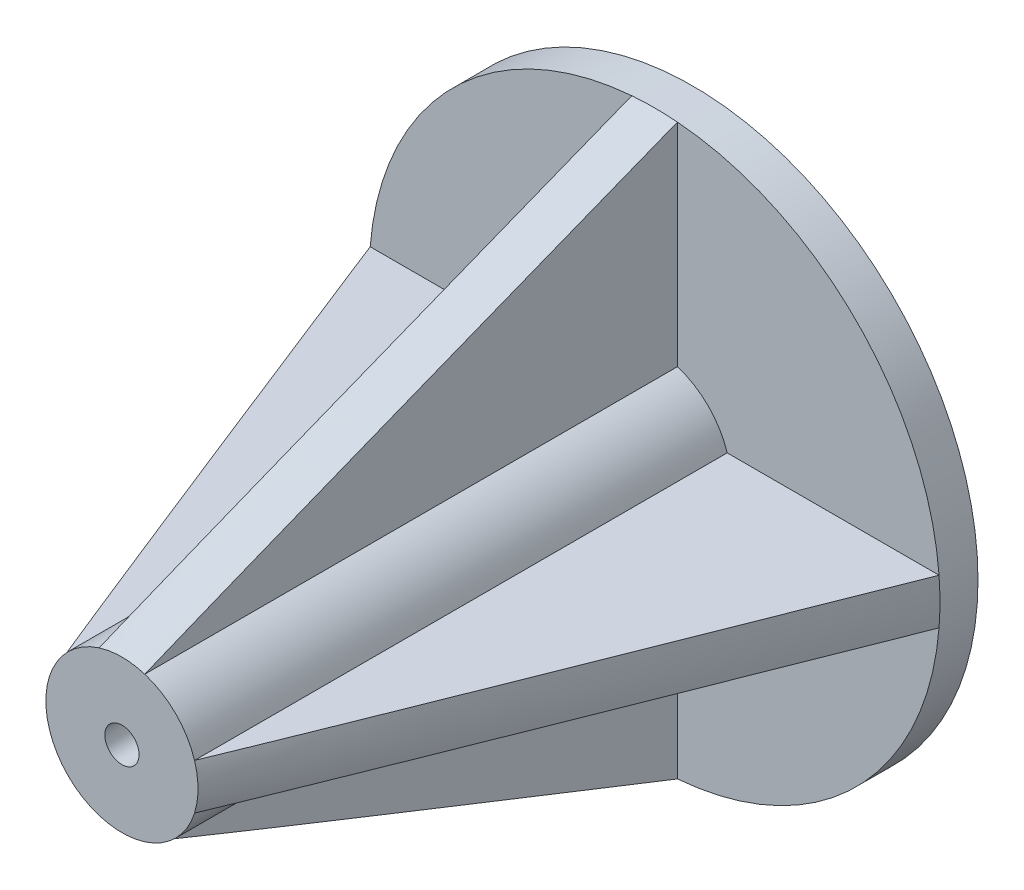
from build123d import *

# Parameters (mm, degrees)
SKETCH1_R           = 15
SKETCH1_R_2         = 0.9
BOSS_EXTRUDE1_DEPTH = 2
SKETCH1_3_R         = 4
SKETCH1_3_R_2       = 0.9
BOSS_EXTRUDE2_DEPTH = 30
BOSS_EXTRUDE3_DEPTH = 28
CHAMFER1_SIZE       = 28
CHAMFER1_SIZE_2     = 11


with BuildPart() as part:
    # Sketch1 → Boss-Extrude1 (new body)
    with BuildSketch(Plane.XY):
        Circle(SKETCH1_R)
        Circle(SKETCH1_R_2, mode=Mode.SUBTRACT)
    extrude(amount=BOSS_EXTRUDE1_DEPTH)

    # Sketch1<3> → Boss-Extrude2 (add)
    with BuildSketch(Plane.XY):
        Circle(SKETCH1_3_R)
        Circle(SKETCH1_3_R_2, mode=Mode.SUBTRACT)
    extrude(amount=BOSS_EXTRUDE2_DEPTH)

    # Sketch2 → Boss-Extrude3 (add)
    with BuildSketch(Plane.XY.offset(2)):
        with BuildLine():
            ThreePointArc((1.2, 14.951922953), (0, 15), (-1.2, 14.951922953))
            Line((-1.2, 14.951922953), (-1.2, 3.815756806))
            ThreePointArc((-1.2, 3.815756806), (0, 4), (1.2, 3.815756806))
            Line((1.2, 3.815756806), (1.2, 14.951922953))
        make_face()
        with BuildLine():
            Line((-3.815756806, 1.2), (-14.951922953, 1.2))
            ThreePointArc((-14.951922953, 1.2), (-15, 0), (-14.951922953, -1.2))
            Line((-14.951922953, -1.2), (-3.815756806, -1.2))
            ThreePointArc((-3.815756806, -1.2), (-4, 0), (-3.815756806, 1.2))
        make_face()
        with BuildLine():
            ThreePointArc((14.951922953, -1.2), (15, 0), (14.951922953, 1.2))
            Line((14.951922953, 1.2), (3.815756806, 1.2))
            ThreePointArc((3.815756806, 1.2), (4, 0), (3.815756806, -1.2))
            Line((3.815756806, -1.2), (14.951922953, -1.2))
        make_face()
        with BuildLine():
            Line((-1.2, -3.815756806), (-1.2, -14.951922953))
            ThreePointArc((-1.2, -14.951922953), (0, -15), (1.2, -14.951922953))
            Line((1.2, -14.951922953), (1.2, -3.815756806))
            ThreePointArc((1.2, -3.815756806), (0, -4), (-1.2, -3.815756806))
        make_face()
    extrude(amount=BOSS_EXTRUDE3_DEPTH)

    # Chamfer1
    # the kernel refuses this chamfer: 28, 11 mm, written as the material it takes off along each edge
    with BuildSketch(Plane(origin=(0, 0, 30), x_dir=(0.9999950652018581, 0.0031415874858912577, 0), z_dir=(0.0031415874858912577, -0.9999950652018581, 0))) as chamfer1_piece_1:
        Polygon((15, -CHAMFER1_SIZE), (15 - CHAMFER1_SIZE_2, 0), (15, 0), align=None)
    revolve(axis=Axis((0, 0, 30), (0, 0, 1)), revolution_arc=359.64, mode=Mode.SUBTRACT)
    with BuildSketch(Plane(origin=(0, 0, 30), x_dir=(0.0031415874858795345, -0.9999950652018582, 0), z_dir=(-0.9999950652018582, -0.0031415874858795345, 0))) as chamfer1_piece_2:
        Polygon((15, -CHAMFER1_SIZE), (15 - CHAMFER1_SIZE_2, 0), (15, 0), align=None)
    revolve(axis=Axis((0, 0, 30), (0, 0, 1)), revolution_arc=359.64, mode=Mode.SUBTRACT)
    with BuildSketch(Plane(origin=(0, 0, 30), x_dir=(-0.9999950652018582, -0.00314158748587628, 0), z_dir=(-0.00314158748587628, 0.9999950652018582, 0))) as chamfer1_piece_3:
        Polygon((15, -CHAMFER1_SIZE), (15 - CHAMFER1_SIZE_2, 0), (15, 0), align=None)
    revolve(axis=Axis((0, 0, 30), (0, 0, 1)), revolution_arc=359.64, mode=Mode.SUBTRACT)
    with BuildSketch(Plane(origin=(0, 0, 30), x_dir=(-0.003141587485897415, 0.9999950652018581, 0), z_dir=(0.9999950652018581, 0.003141587485897415, 0))) as chamfer1_piece_4:
        Polygon((15, -CHAMFER1_SIZE), (15 - CHAMFER1_SIZE_2, 0), (15, 0), align=None)
    revolve(axis=Axis((0, 0, 30), (0, 0, 1)), revolution_arc=359.64, mode=Mode.SUBTRACT)


solid = part.part
